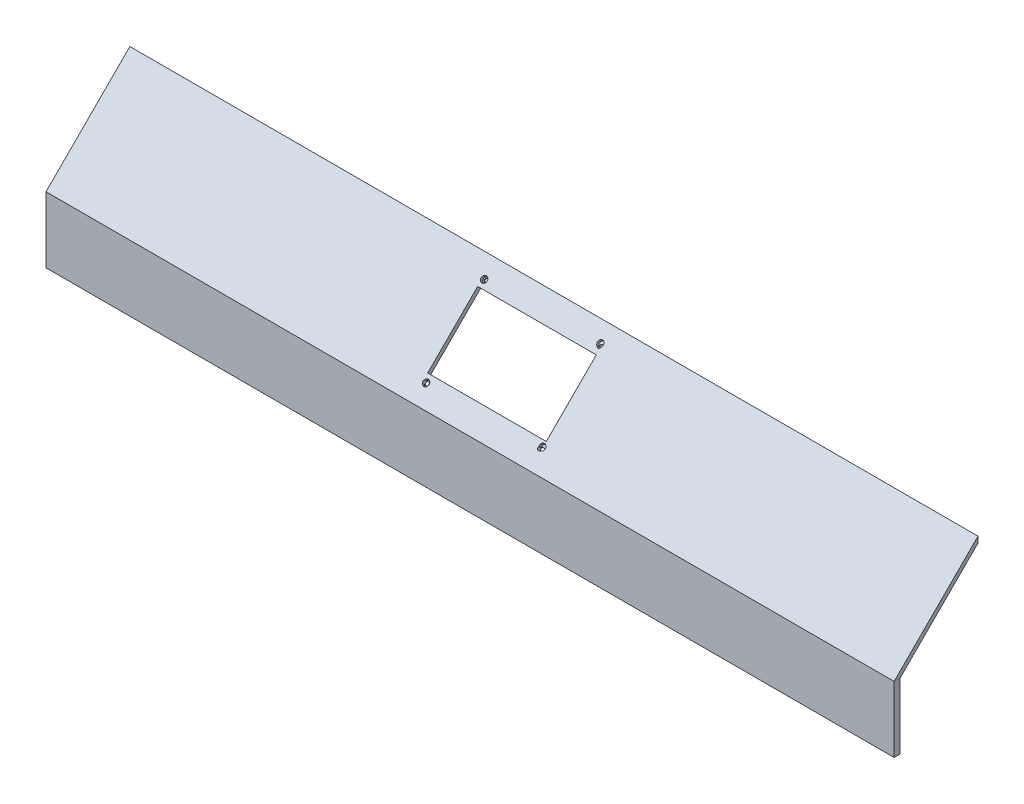
from build123d import *

# Parameters (mm, degrees)
BOSS_EXTRUDE1_DEPTH = 708
SKETCH2_R           = 1.6
SKETCH2_W           = 99
SKETCH2_H           = 59
CUT_EXTRUDE1_DEPTH  = 708
SKETCH3_W           = 5
SKETCH3_H           = 10
BOSS_EXTRUDE2_DEPTH = 20
FILLET1_R           = 5
SKETCH4_R           = 2.65
CUT_EXTRUDE2_DEPTH  = 10
SKETCH6_R           = 2.5
CUT_EXTRUDE3_DEPTH  = 2.5


with BuildPart() as part:
    # Sketch1 → Boss-Extrude1 (new body)
    with BuildSketch(Plane(origin=(0, 0, 0), x_dir=(0, 0, -1), z_dir=(1, 0, 0))):
        Polygon((0, 0), (0, 55), (70, 125), (70, 120), (5, 55), (5, 0), align=None)
    extrude(amount=BOSS_EXTRUDE1_DEPTH)

    # Sketch2 → Cut-Extrude1 (cut)
    with BuildSketch(Plane(origin=(0, 27.5, 27.5), x_dir=(1, 0, 0), z_dir=(0, 0.7071067811865477, 0.7071067811865475))):
        with Locations(Location((306, 123.388347648, 0), (0, 0, 270))):
            Circle(SKETCH2_R)
        with Locations(Location((402, 123.388347648, 0), (0, 0, 270))):
            Circle(SKETCH2_R)
        with Locations(Location((402, 53.388347648, 0), (0, 0, 270))):
            Circle(SKETCH2_R)
        with Locations(Location((306, 53.388347648, 0), (0, 0, 270))):
            Circle(SKETCH2_R)
        with Locations((354, 88.388347648)):
            Rectangle(SKETCH2_W, SKETCH2_H)
    extrude(amount=-CUT_EXTRUDE1_DEPTH, mode=Mode.SUBTRACT)

    # Sketch3 → Boss-Extrude2 (add)
    with BuildSketch(Plane(origin=(0, 0, -5), x_dir=(-1, 0, 0), z_dir=(0, 0, -1))):
        with Locations((-681.5, 45)):
            Rectangle(SKETCH3_W, SKETCH3_H)
        with Locations((-681.5, 15)):
            Rectangle(SKETCH3_W, SKETCH3_H)
    extrude(amount=BOSS_EXTRUDE2_DEPTH)

    # Fillet1
    fillet1_edges = [part.edges().sort_by_distance(p)[0] for p in [
        (681.5, 10, -25),
        (681.5, 20, -25),
        (681.5, 40, -25),
        (681.5, 50, -25),
    ]]
    fillet(fillet1_edges, radius=FILLET1_R - 0.0001)  # a hair under: the kernel refuses the full size

    # Sketch4 → Cut-Extrude2 (cut)
    with BuildSketch(Plane(origin=(684, 0, 0), x_dir=(0, 0, -1), z_dir=(1, 0, 0))):
        with Locations((15, 45)):
            Circle(SKETCH4_R)
        with Locations((15, 15)):
            Circle(SKETCH4_R)
    extrude(amount=-CUT_EXTRUDE2_DEPTH, mode=Mode.SUBTRACT)

    # Sketch6 → Cut-Extrude3 (cut)
    with BuildSketch(Plane(origin=(0, 27.5, 27.5), x_dir=(1, 0, 0), z_dir=(0, 0.7071067811865477, 0.7071067811865475))):
        with Locations(Location((306, 123.388347648, 0), (0, 0, 270))):
            Circle(SKETCH6_R)
        with Locations((401.98883184, 124.852643374)):
            Circle(SKETCH6_R)
        with Locations((403.056547473, 54.860786824)):
            Circle(SKETCH6_R)
        with Locations((307.067715633, 53.396491098)):
            Circle(SKETCH6_R)
    extrude(amount=-CUT_EXTRUDE3_DEPTH, mode=Mode.SUBTRACT)


with BuildPart() as body_2:
    # Split1: the piece on the far side of the plane
    add(part.part)
    split(bisect_by=Plane(origin=(0, 55, 0), x_dir=(0, 0, -1), z_dir=(0, -1, 0)), keep=Keep.BOTTOM)


with BuildPart() as part_1:
    add(part.part)

    # Split1
    split(bisect_by=Plane(origin=(0, 55, 0), x_dir=(0, 0, -1), z_dir=(0, -1, 0)), keep=Keep.TOP)


solid = Compound([body_2.part, part_1.part])
